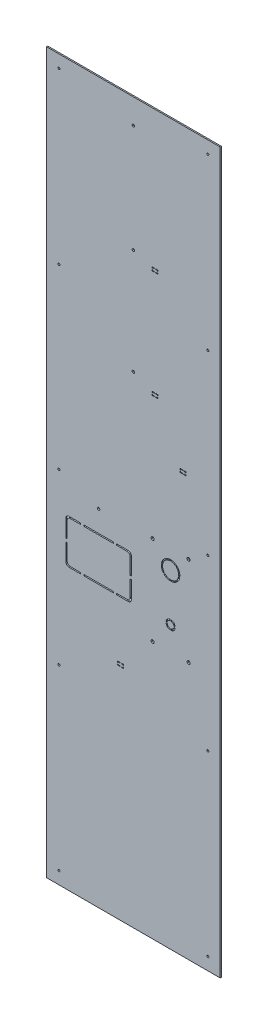
from build123d import *

# Parameters (mm, degrees)
SKETCH2_W               = 280
SKETCH2_H               = 1160
BOSS_EXTRUDE1_DEPTH     = 2
CUT_EXTRUDE1_DEPTH      = 1
CUT_EXTRUDE1_DEPTH_BACK = 2
SKETCH3_R               = 1.65
SKETCH3_R_2             = 2
SKETCH3_R_3             = 2.5
SKETCH3_W               = 47.75
SKETCH3_H               = 2


with BuildPart() as part:
    # Sketch2 → Boss-Extrude1 (new body)
    with BuildSketch(Plane.XY):
        Rectangle(SKETCH2_W, SKETCH2_H)
    extrude(amount=-BOSS_EXTRUDE1_DEPTH)

    # Sketch3 → Cut-Extrude1 (cut, two sides: drawn at the far end of the back side and taken through both)
    with BuildSketch(Plane.XY.offset(-CUT_EXTRUDE1_DEPTH_BACK)):
        with Locations((-120, 560)):
            Circle(SKETCH3_R)
        with Locations((120, 560)):
            Circle(SKETCH3_R)
        with Locations((-120, 286.18)):
            Circle(SKETCH3_R)
        with Locations((120, 286.18)):
            Circle(SKETCH3_R)
        with Locations((-120, 0)):
            Circle(SKETCH3_R)
        with Locations((120, 0)):
            Circle(SKETCH3_R)
        with Locations((-120, -273)):
            Circle(SKETCH3_R)
        with Locations((120, -273)):
            Circle(SKETCH3_R)
        with Locations((-120, -560)):
            Circle(SKETCH3_R)
        with Locations((120, -560)):
            Circle(SKETCH3_R)
        with Locations((0, 540)):
            Circle(SKETCH3_R_2)
        with Locations((30.999987721, -21)):
            Circle(SKETCH3_R_3)
        with Locations((88.999987721, -21)):
            Circle(SKETCH3_R_3)
        with Locations((88.999987721, -165)):
            Circle(SKETCH3_R_3)
        with Locations((30.999987721, -165)):
            Circle(SKETCH3_R_3)
        with Locations((-56.000012279, -23)):
            Circle(SKETCH3_R_2)
        with Locations((0, 366.18)):
            Circle(SKETCH3_R_2)
        with Locations((0, 196.18)):
            Circle(SKETCH3_R_2)
        Polygon((30.1, 354), (31.1, 354), (31.1, 353.1), (34, 353.1), (34, 352.1), (30.1, 352.1), align=None)
        Polygon((36, 352.1), (36, 353.1), (38.9, 353.1), (38.9, 354), (39.9, 354), (39.9, 352.1), align=None)
        Polygon((39.9, 356), (38.9, 356), (38.9, 356.9), (36, 356.9), (36, 357.9), (39.9, 357.9), align=None)
        Polygon((34, 357.9), (34, 356.9), (31.1, 356.9), (31.1, 356), (30.1, 356), (30.1, 357.9), align=None)
        Polygon((30.1, 182.18), (31.1, 182.18), (31.1, 183.08), (34, 183.08), (34, 184.08), (30.1, 184.08), align=None)
        Polygon((36, 184.08), (36, 183.08), (38.9, 183.08), (38.9, 182.18), (39.9, 182.18), (39.9, 184.08), align=None)
        Polygon((39.9, 180.18), (38.9, 180.18), (38.9, 179.28), (36, 179.28), (36, 178.28), (39.9, 178.28), align=None)
        Polygon((34, 178.28), (34, 179.28), (31.1, 179.28), (31.1, 180.18), (30.1, 180.18), (30.1, 178.28), align=None)
        Polygon((75.1, 97.18), (76.1, 97.18), (76.1, 98.08), (79, 98.08), (79, 99.08), (75.1, 99.08), align=None)
        with BuildLine():
            Line((60, -36), (60.00001461, -38.000005513))
            ThreePointArc((60.00001461, -38.000005513), (64.40229458, -38.768082792), (68.284375962, -40.981554223))
            Line((68.284375962, -40.981554223), (69.558885127, -39.44026342))
            ThreePointArc((69.558885127, -39.44026342), (65.079558828, -36.88624879), (60, -36))
        make_face()
        Polygon((81, 99.08), (81, 98.08), (83.9, 98.08), (83.9, 97.18), (84.9, 97.18), (84.9, 99.08), align=None)
        with BuildLine():
            Line((59.000556004, -36.033342163), (59.122400034, -38.029662698))
            ThreePointArc((59.122400034, -38.029662698), (54.411111276, -39.262707552), (50.484141952, -42.142907772))
            Line((50.484141952, -42.142907772), (49.02015594, -40.780271897))
            ThreePointArc((49.02015594, -40.780271897), (53.557238864, -37.45413019), (59.000556004, -36.033342163))
        make_face()
        Polygon((84.9, 95.18), (83.9, 95.18), (83.9, 94.28), (81, 94.28), (81, 93.28), (84.9, 93.28), align=None)
        Polygon((79, 93.28), (79, 94.28), (76.1, 94.28), (76.1, 95.18), (75.1, 95.18), (75.1, 93.28), align=None)
        with BuildLine():
            Line((-108.75, -90.5), (-108.75, -62.45))
            ThreePointArc((-108.75, -62.45), (-107.285533906, -58.914466094), (-103.75, -57.45))
            Line((-103.75, -57.45), (-84.875, -57.45))
            Line((-84.875, -57.45), (-84.875, -59.45))
            Line((-84.875, -59.45), (-101.75, -59.45))
            ThreePointArc((-101.75, -59.45), (-105.285533906, -60.914466094), (-106.75, -64.45))
            Line((-106.75, -64.45), (-106.75, -90.5))
            Line((-106.75, -90.5), (-108.75, -90.5))
        make_face()
        with BuildLine():
            Line((-108.75, -95.5), (-106.75, -95.5))
            Line((-106.75, -95.5), (-106.75, -121.55))
            ThreePointArc((-106.75, -121.55), (-105.285533906, -125.085533906), (-101.75, -126.55))
            Line((-101.75, -126.55), (-84.875, -126.55))
            Line((-84.875, -126.55), (-84.875, -128.55))
            Line((-84.875, -128.55), (-103.75, -128.55))
            ThreePointArc((-103.75, -128.55), (-107.285533906, -127.085533906), (-108.75, -123.55))
            Line((-108.75, -123.55), (-108.75, -95.5))
        make_face()
        with Locations((-56, -58.45)):
            Rectangle(SKETCH3_W, SKETCH3_H)
        with BuildLine():
            Line((-27.125, -57.45), (-27.125, -59.45))
            Line((-27.125, -59.45), (-10.25, -59.45))
            ThreePointArc((-10.25, -59.45), (-6.714466094, -60.914466094), (-5.25, -64.45))
            Line((-5.25, -64.45), (-5.25, -90.5))
            Line((-5.25, -90.5), (-3.25, -90.5))
            Line((-3.25, -90.5), (-3.25, -62.45))
            ThreePointArc((-3.25, -62.45), (-4.714466094, -58.914466094), (-8.25, -57.45))
            Line((-8.25, -57.45), (-27.125, -57.45))
        make_face()
        with BuildLine():
            Line((-3.25, -95.5), (-5.25, -95.5))
            Line((-5.25, -95.5), (-5.25, -121.55))
            ThreePointArc((-5.25, -121.55), (-6.714466094, -125.085533906), (-10.25, -126.55))
            Line((-10.25, -126.55), (-27.125, -126.55))
            Line((-27.125, -126.55), (-27.125, -128.55))
            Line((-27.125, -128.55), (-8.25, -128.55))
            ThreePointArc((-8.25, -128.55), (-4.714466094, -127.085533906), (-3.25, -123.55))
            Line((-3.25, -123.55), (-3.25, -95.5))
        make_face()
        with Locations((-56, -127.55)):
            Rectangle(SKETCH3_W, SKETCH3_H)
        with BuildLine():
            Line((74.933661101, -52.409179713), (72.94252229, -52.221291353))
            ThreePointArc((72.94252229, -52.221291353), (72.168738974, -46.425929265), (68.933492433, -41.555801733))
            Line((68.933492433, -41.555801733), (70.307864595, -40.102856625))
            ThreePointArc((70.307864595, -40.102856625), (74.040835155, -45.722230337), (74.933661101, -52.409179713))
        make_face()
        with BuildLine():
            Line((74.806582661, -53.401072383), (72.832387322, -53.080932568))
            ThreePointArc((72.832387322, -53.080932568), (71.39953375, -57.249087296), (68.656303527, -60.698909196))
            Line((68.656303527, -60.698909196), (69.988033372, -62.191040241))
            ThreePointArc((69.988033372, -62.191040241), (73.153293496, -58.210477998), (74.806582661, -53.401072383))
        make_face()
        with BuildLine():
            Line((60, -66.000017478), (60.00001461, -64.000008617))
            ThreePointArc((60.00001461, -64.000008617), (64.224735631, -63.294386783), (67.990832799, -61.254121606))
            Line((67.990832799, -61.254121606), (69.220183567, -62.831670149))
            ThreePointArc((69.220183567, -62.831670149), (64.874684241, -65.185832318), (60, -66.000017478))
        make_face()
        with BuildLine():
            Line((59.000541044, -65.96712681), (59.000541044, -63.961530623))
            ThreePointArc((59.000541044, -63.961530623), (54.566773379, -62.810169218), (50.807625358, -60.192396318))
            Line((50.807625358, -60.192396318), (49.393414477, -61.606607198))
            ThreePointArc((49.393414477, -61.606607198), (53.800950165, -64.659397705), (59.000541044, -65.96712681))
        make_face()
        with BuildLine():
            Line((60.980600924, -119.564383163), (60.71910407, -121.54721432))
            ThreePointArc((60.71910407, -121.54721432), (63.889075017, -123.110912704), (65.452773401, -126.280883651))
            Line((65.452773401, -126.280883651), (67.435604557, -126.019386797))
            ThreePointArc((67.435604557, -126.019386797), (65.30328858, -121.696699141), (60.980600924, -119.564383163))
        make_face()
        with BuildLine():
            Line((58.987382691, -119.568672322), (59.257410699, -121.550359703))
            ThreePointArc((59.257410699, -121.550359703), (56.102540613, -123.119290524), (54.54720204, -126.280883651))
            Line((54.54720204, -126.280883651), (52.564370884, -126.019386797))
            ThreePointArc((52.564370884, -126.019386797), (54.685287119, -121.708123441), (58.987382691, -119.568672322))
        make_face()
        with BuildLine():
            Line((67.435604557, -127.980613203), (65.452773401, -127.719116349))
            ThreePointArc((65.452773401, -127.719116349), (63.889075017, -130.889087296), (60.71910407, -132.45278568))
            Line((60.71910407, -132.45278568), (60.980600924, -134.435616836))
            ThreePointArc((60.980600924, -134.435616836), (65.303288579, -132.303300859), (67.435604557, -127.980613203))
        make_face()
        with BuildLine():
            Line((52.564370884, -127.980613203), (54.54720204, -127.719116349))
            ThreePointArc((54.54720204, -127.719116349), (56.102540613, -130.880709476), (59.257410699, -132.449640297))
            Line((59.257410699, -132.449640297), (58.987382691, -134.431327677))
            ThreePointArc((58.987382691, -134.431327677), (54.685287119, -132.291876559), (52.564370884, -127.980613203))
        make_face()
        with BuildLine():
            Line((45.263274159, -48.201990118), (47.228183224, -48.575061007))
            ThreePointArc((47.228183224, -48.575061007), (48.212106329, -45.518651513), (49.915143539, -42.796628748))
            Line((49.915143539, -42.796628748), (48.363618413, -41.534565259))
            ThreePointArc((48.363618413, -41.534565259), (46.398572229, -44.675361768), (45.263274159, -48.201990118))
        make_face()
        with BuildLine():
            Line((45.108152373, -49.201990118), (47.093744677, -49.441726999))
            ThreePointArc((47.093744677, -49.441726999), (47.511194531, -54.609634938), (49.915144959, -59.203387129))
            Line((49.915144959, -59.203387129), (48.363618413, -60.46545222))
            ThreePointArc((48.363618413, -60.46545222), (45.589825437, -55.164965615), (45.108152373, -49.201990118))
        make_face()
        Polygon((-16.644187178, -221.1), (-19.544187178, -221.1), (-19.544187178, -220.1), (-15.644187178, -220.1), (-15.644187178, -222), (-16.644187178, -222), align=None)
        Polygon((-15.644187178, -224), (-15.644187178, -225.9), (-19.544187178, -225.9), (-19.544187178, -224.9), (-16.644187178, -224.9), (-16.644187178, -224), align=None)
        Polygon((-24.444187178, -222), (-25.444187178, -222), (-25.444187178, -220.1), (-21.544187178, -220.1), (-21.544187178, -221.1), (-24.444187178, -221.1), align=None)
        Polygon((-21.544187178, -225.9), (-25.444187178, -225.9), (-25.444187178, -224), (-24.444187178, -224), (-24.444187178, -224.9), (-21.544187178, -224.9), align=None)
    extrude(amount=CUT_EXTRUDE1_DEPTH + CUT_EXTRUDE1_DEPTH_BACK, mode=Mode.SUBTRACT)


solid = part.part
